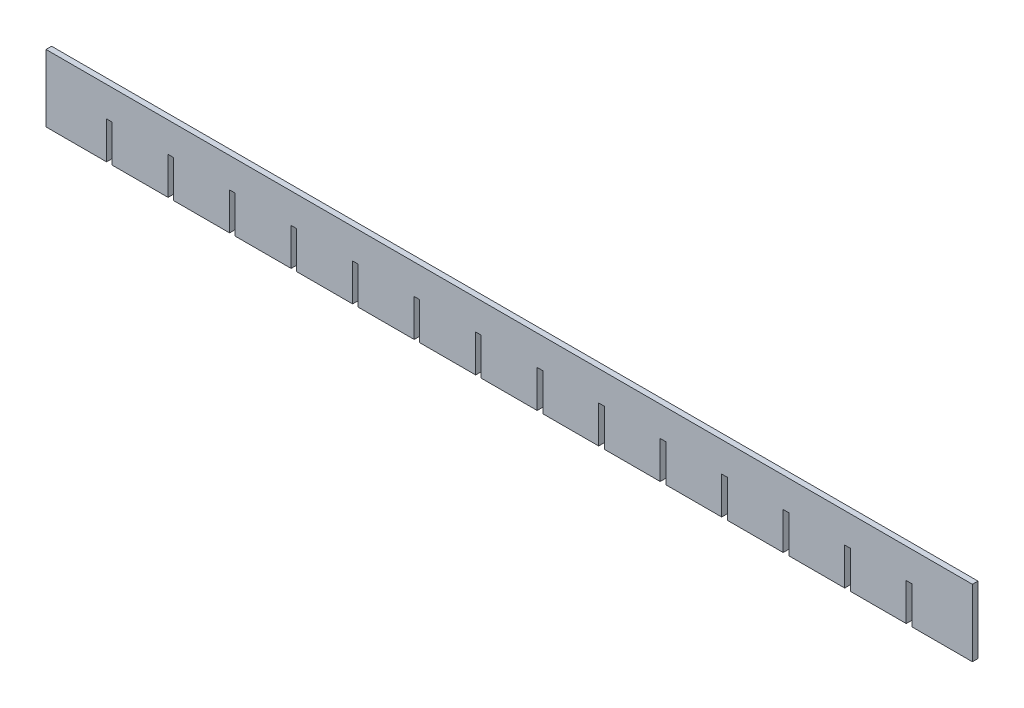
from build123d import *

# Parameters (mm, degrees)
SKETCH1_W           = 497
SKETCH1_H           = 36
BOSS_EXTRUDE1_DEPTH = 3
SKETCH2_W           = 3
SKETCH2_H           = 20
CUT_EXTRUDE1_DEPTH  = 250.169119274
LPATTERN1_COUNT     = 14
LPATTERN1_PITCH     = 33


with BuildPart() as part:
    # Sketch1 → Boss-Extrude1 (new body)
    with BuildSketch(Plane.XY):
        Rectangle(SKETCH1_W, SKETCH1_H)
    extrude(amount=BOSS_EXTRUDE1_DEPTH)

    # Sketch2 → Cut-Extrude1 (cut, through all)
    with BuildSketch(Plane.XY.offset(3)):
        with Locations((-214.5, -8)):
            Rectangle(SKETCH2_W, SKETCH2_H)
    cut_extrude1 = extrude(amount=-CUT_EXTRUDE1_DEPTH, mode=Mode.SUBTRACT)

    # LPattern1: Cut-Extrude1 ×14
    with Locations(*[(i * LPATTERN1_PITCH, 0, 0) for i in range(1, LPATTERN1_COUNT)]):
        add(cut_extrude1, mode=Mode.SUBTRACT)


solid = part.part
